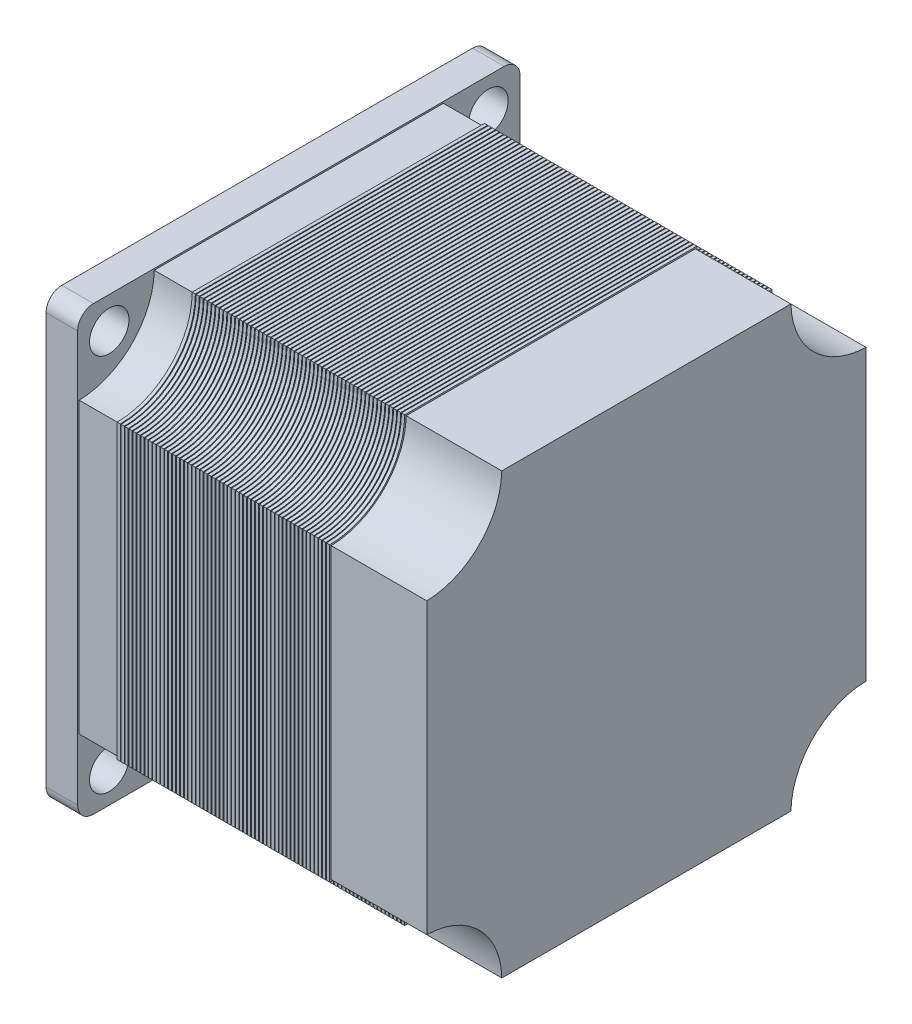
from build123d import *

# Parameters (mm, degrees)
SKETCH1_R           = 3
BOSS_EXTRUDE1_DEPTH = 27
CUT_EXTRUDE4_START  = -0.1
CUT_EXTRUDE4_DEPTH  = 0.1
LPATTERN5_COUNT     = 55
LPATTERN5_PITCH     = 0.5
BOSS_EXTRUDE4_DEPTH = 12
BOSS_EXTRUDE5_START = 5
BOSS_EXTRUDE5_DEPTH = 5
SKETCH14_R          = 2.5
BOSS_EXTRUDE7_DEPTH = 4
SKETCH15_R          = 19
BOSS_EXTRUDE8_DEPTH = 2
SKETCH16_R          = 3
CUT_EXTRUDE6_DEPTH  = 10


with BuildPart() as part:
    # Sketch1 → Boss-Extrude1 (new body)
    with BuildSketch(Plane(origin=(0, 0, 0), x_dir=(0, 0, -1), z_dir=(1, 0, 0))):
        with BuildLine():
            Line((-18.5, 28), (18.5, 28))
            ThreePointArc((18.5, 28), (21.282485579, 21.282485579), (28, 18.5))
            Line((28, 18.5), (28, -18.5))
            ThreePointArc((28, -18.5), (21.282485579, -21.282485579), (18.5, -28))
            Line((18.5, -28), (-18.5, -28))
            ThreePointArc((-18.5, -28), (-21.282485579, -21.282485579), (-28, -18.5))
            Line((-28, -18.5), (-28, 18.5))
            ThreePointArc((-28, 18.5), (-21.282485579, 21.282485579), (-18.5, 28))
        make_face()
        Circle(SKETCH1_R, mode=Mode.SUBTRACT)
    extrude(amount=BOSS_EXTRUDE1_DEPTH)

    # Sketch6 → Cut-Extrude4 (cut)
    with BuildSketch(Plane(origin=(27, 0, 0), x_dir=(0, 0, -1), z_dir=(1, 0, 0)).offset(CUT_EXTRUDE4_START)):
        with BuildLine():
            Line((28, -18.5), (28, 18.5))
            ThreePointArc((28, 18.5), (21.282485579, 21.282485579), (18.5, 28))
            Line((18.5, 28), (-18.5, 28))
            ThreePointArc((-18.5, 28), (-21.282485579, 21.282485579), (-28, 18.5))
            Line((-28, 18.5), (-28, -18.5))
            ThreePointArc((-28, -18.5), (-21.282485579, -21.282485579), (-18.5, -28))
            Line((-18.5, -28), (18.5, -28))
            ThreePointArc((18.5, -28), (21.282485579, -21.282485579), (28, -18.5))
        make_face()
        with BuildLine():
            Line((18.302062075, 27.8), (-18.302062075, 27.8))
            ThreePointArc((-18.302062075, 27.8), (-21.141064222, 21.141064222), (-27.8, 18.302062075))
            Line((-27.8, 18.302062075), (-27.8, -18.302062075))
            ThreePointArc((-27.8, -18.302062075), (-21.141064222, -21.141064222), (-18.302062075, -27.8))
            Line((-18.302062075, -27.8), (18.302062075, -27.8))
            ThreePointArc((18.302062075, -27.8), (21.141064222, -21.141064222), (27.8, -18.302062075))
            Line((27.8, -18.302062075), (27.8, 18.302062075))
            ThreePointArc((27.8, 18.302062075), (21.141064222, 21.141064222), (18.302062075, 27.8))
        make_face(mode=Mode.SUBTRACT)
    cut_extrude4 = extrude(amount=CUT_EXTRUDE4_DEPTH, mode=Mode.SUBTRACT)

    # LPattern5: Cut-Extrude4 ×55
    with Locations(*[(-i * LPATTERN5_PITCH, 0, 0) for i in range(1, LPATTERN5_COUNT)]):
        add(cut_extrude4, mode=Mode.SUBTRACT)

    # Sketch10 → Boss-Extrude4 (add)
    with BuildSketch(Plane(origin=(27, 0, 0), x_dir=(0, 0, -1), z_dir=(1, 0, 0))):
        with BuildLine():
            Line((27.8, -18.302062075), (27.8, 18.302062075))
            ThreePointArc((27.8, 18.302062075), (21.141064222, 21.141064222), (18.302062075, 27.8))
            Line((18.302062075, 27.8), (-18.302062075, 27.8))
            ThreePointArc((-18.302062075, 27.8), (-21.141064222, 21.141064222), (-27.8, 18.302062075))
            Line((-27.8, 18.302062075), (-27.8, -18.302062075))
            ThreePointArc((-27.8, -18.302062075), (-21.141064222, -21.141064222), (-18.302062075, -27.8))
            Line((-18.302062075, -27.8), (18.302062075, -27.8))
            ThreePointArc((18.302062075, -27.8), (21.141064222, -21.141064222), (27.8, -18.302062075))
        make_face()
    extrude(amount=BOSS_EXTRUDE4_DEPTH)

    # Sketch12 → Boss-Extrude5 (add)
    with BuildSketch(Plane.ZY.offset(BOSS_EXTRUDE5_START)):
        with BuildLine():
            Line((-27.8, 18.302062075), (-27.8, -18.302062075))
            ThreePointArc((-27.8, -18.302062075), (-21.141064222, -21.141064222), (-18.302062075, -27.8))
            Line((-18.302062075, -27.8), (18.302062075, -27.8))
            ThreePointArc((18.302062075, -27.8), (21.141064222, -21.141064222), (27.8, -18.302062075))
            Line((27.8, -18.302062075), (27.8, 18.302062075))
            ThreePointArc((27.8, 18.302062075), (21.141064222, 21.141064222), (18.302062075, 27.8))
            Line((18.302062075, 27.8), (-18.302062075, 27.8))
            ThreePointArc((-18.302062075, 27.8), (-21.141064222, 21.141064222), (-27.8, 18.302062075))
        make_face()
    extrude(amount=-BOSS_EXTRUDE5_DEPTH)

    # Sketch14 → Boss-Extrude7 (add)
    with BuildSketch(Plane.ZY.offset(5)):
        with BuildLine():
            Line((-26, 28), (26, 28))
            ThreePointArc((26, 28), (27.414213562, 27.414213562), (28, 26))
            Line((28, 26), (28, -26))
            ThreePointArc((28, -26), (27.414213562, -27.414213562), (26, -28))
            Line((26, -28), (-26, -28))
            ThreePointArc((-26, -28), (-27.414213562, -27.414213562), (-28, -26))
            Line((-28, -26), (-28, 26))
            ThreePointArc((-28, 26), (-27.414213562, 27.414213562), (-26, 28))
        make_face()
        with Locations((-24, 24)):
            Circle(SKETCH14_R, mode=Mode.SUBTRACT)
        with Locations((24, 24)):
            Circle(SKETCH14_R, mode=Mode.SUBTRACT)
        with Locations((24, -24)):
            Circle(SKETCH14_R, mode=Mode.SUBTRACT)
        with Locations((-24, -24)):
            Circle(SKETCH14_R, mode=Mode.SUBTRACT)
    extrude(amount=BOSS_EXTRUDE7_DEPTH)

    # Sketch15 → Boss-Extrude8 (add)
    with BuildSketch(Plane.ZY.offset(9)):
        Circle(SKETCH15_R)
    extrude(amount=BOSS_EXTRUDE8_DEPTH)

    # Sketch16 → Cut-Extrude6 (cut)
    with BuildSketch(Plane.ZY.offset(11)):
        Circle(SKETCH16_R)
    extrude(amount=-CUT_EXTRUDE6_DEPTH, mode=Mode.SUBTRACT)


solid = part.part
